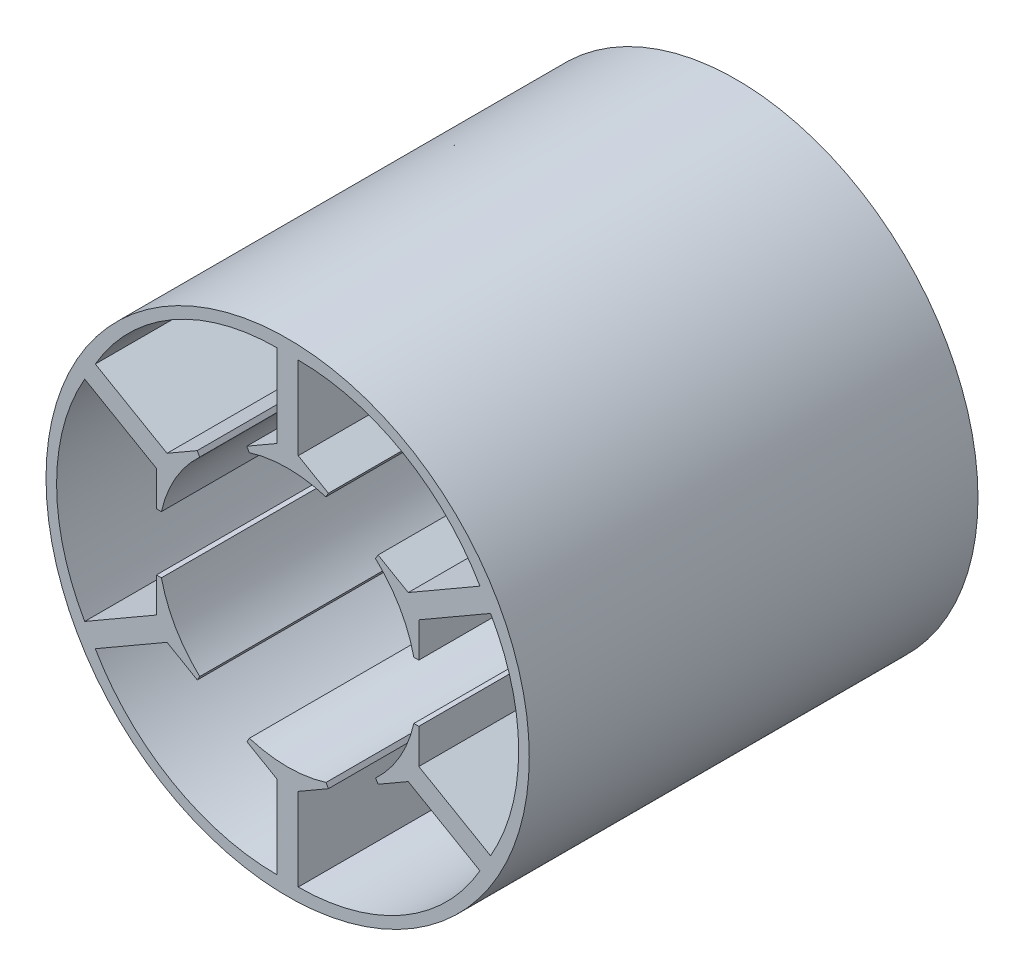
from build123d import *

# Parameters (mm, degrees)
MOTOR_BASE_R                    = 35
STATOR_SHELL_DEPTH              = 65
MOTOR_BASE_4_R                  = 18.75
CUT_EXTRUDE1_DEPTH              = 82.700673192
STATOR_LAMINATION_SUPPORT_DEPTH = 17.35
CUT_EXTRUDE3_DEPTH              = 82.700673192


with BuildPart() as part:
    # Motor_Base → Stator_Shell (new body)
    with BuildSketch(Plane.XY):
        Circle(MOTOR_BASE_R)
        with BuildLine():
            Line((1.533091596, 21.069409042), (1.533091596, 33.069409042))
            ThreePointArc((1.533091596, 33.069409042), (16.733091596, 28.996581317), (27.860263871, 17.869409042))
            Line((27.860263871, 17.869409042), (17.467959025, 11.869409042))
            Line((17.467959025, 11.869409042), (1.533091596, 21.069409042))
        make_face(mode=Mode.SUBTRACT)
        with BuildLine():
            Line((-1.533091596, 21.069409042), (-1.533091596, 33.069409042))
            ThreePointArc((-1.533091596, 33.069409042), (-16.733091596, 28.996581317), (-27.860263871, 17.869409042))
            Line((-27.860263871, 17.869409042), (-17.467959025, 11.869409042))
            Line((-17.467959025, 11.869409042), (-1.533091596, 21.069409042))
        make_face(mode=Mode.SUBTRACT)
        with BuildLine():
            Line((19.001050621, 9.214016506), (29.393355467, 15.214016506))
            ThreePointArc((29.393355467, 15.214016506), (33.466183191, 0.014016506), (29.393355467, -15.185983494))
            Line((29.393355467, -15.185983494), (19.001050621, -9.185983494))
            Line((19.001050621, -9.185983494), (19.001050621, 9.214016506))
        make_face(mode=Mode.SUBTRACT)
        with BuildLine():
            Line((17.467959025, -11.841376031), (27.860263871, -17.841376031))
            ThreePointArc((27.860263871, -17.841376031), (16.733091596, -28.968548306), (1.533091596, -33.041376031))
            Line((1.533091596, -33.041376031), (1.533091596, -21.041376031))
            Line((1.533091596, -21.041376031), (17.467959025, -11.841376031))
        make_face(mode=Mode.SUBTRACT)
        with BuildLine():
            Line((-1.533091596, -21.041376031), (-1.533091596, -33.041376031))
            ThreePointArc((-1.533091596, -33.041376031), (-16.733091596, -28.968548306), (-27.860263871, -17.841376031))
            Line((-27.860263871, -17.841376031), (-17.467959025, -11.841376031))
            Line((-17.467959025, -11.841376031), (-1.533091596, -21.041376031))
        make_face(mode=Mode.SUBTRACT)
        with BuildLine():
            Line((-19.001050621, -9.185983494), (-29.393355467, -15.185983494))
            ThreePointArc((-29.393355467, -15.185983494), (-33.466183191, 0.014016506), (-29.393355467, 15.214016506))
            Line((-29.393355467, 15.214016506), (-19.001050621, 9.214016506))
            Line((-19.001050621, 9.214016506), (-19.001050621, -9.185983494))
        make_face(mode=Mode.SUBTRACT)
    extrude(amount=STATOR_SHELL_DEPTH)

    # Motor_Base<4> → Cut-Extrude1 (cut, through all)
    with BuildSketch(Plane.XY):
        Circle(MOTOR_BASE_4_R)
    extrude(amount=CUT_EXTRUDE1_DEPTH, mode=Mode.SUBTRACT)

    # Stator_Lam_Support → Stator Lamination Support (add)
    with BuildSketch(Plane(origin=(0, 0, 0), x_dir=(-1, 0, 0), z_dir=(0, 0, -1))):
        with BuildLine():
            Line((14.351295245, 31.306334292), (13.506552589, 28.096442893))
            Line((13.506552589, 28.096442893), (17.559972866, 25.758191299))
            Line((17.559972866, 25.758191299), (19.915725917, 28.096442893))
            ThreePointArc((19.915725917, 28.096442893), (17.208516366, 29.831413083), (14.351295245, 31.306334292))
        make_face()
        with BuildLine():
            Line((34.287728419, 3.224580887), (31.085509595, 2.351203787))
            Line((31.085509595, 2.351203787), (31.087234454, -2.328286942))
            Line((31.087234454, -2.328286942), (34.29009626, -3.199303133))
            ThreePointArc((34.29009626, -3.199303133), (34.439019743, 0.012694207), (34.287728419, 3.224580887))
        make_face()
        with BuildLine():
            Line((19.936433174, -28.081753405), (17.578957007, -25.745239106))
            Line((17.578957007, -25.745239106), (13.527261587, -28.086478241))
            Line((13.527261587, -28.086478241), (14.374370343, -31.295746025))
            ThreePointArc((14.374370343, -31.295746025), (17.230503377, -29.818718876), (19.936433174, -28.081753405))
        make_face()
        with BuildLine():
            Line((-14.351295245, -31.306334292), (-13.506552589, -28.096442893))
            Line((-13.506552589, -28.096442893), (-17.559972866, -25.758191299))
            Line((-17.559972866, -25.758191299), (-19.915725917, -28.096442893))
            ThreePointArc((-19.915725917, -28.096442893), (-17.208516366, -29.831413083), (-14.351295245, -31.306334292))
        make_face()
        with BuildLine():
            Line((-34.287728419, -3.224580887), (-31.085509595, -2.351203787))
            Line((-31.085509595, -2.351203787), (-31.087234454, 2.328286942))
            Line((-31.087234454, 2.328286942), (-34.29009626, 3.199303133))
            ThreePointArc((-34.29009626, 3.199303133), (-34.439019743, -0.012694207), (-34.287728419, -3.224580887))
        make_face()
        with BuildLine():
            Line((-19.936433174, 28.081753405), (-17.578957007, 25.745239106))
            Line((-17.578957007, 25.745239106), (-13.527261587, 28.086478241))
            Line((-13.527261587, 28.086478241), (-14.374370343, 31.295746025))
            ThreePointArc((-14.374370343, 31.295746025), (-17.230503377, 29.818718876), (-19.936433174, 28.081753405))
        make_face()
    extrude(amount=-STATOR_LAMINATION_SUPPORT_DEPTH)

    # Sketch6 → Cut-Extrude3 (cut, through all)
    with BuildSketch(Plane.XY.offset(65)):
        Polygon((14.405256844, 16.666586459), (11.56399771, 11.741189457), (4.374457659, 15.888539677), (7.215716793, 20.813936679), align=None)
        Polygon((21.633256314, 4.15797429), (21.63631569, -4.142025146), (15.950167195, -4.144121058), (15.947107819, 4.155878379), align=None)
        Polygon((14.417539521, -16.655962389), (7.231058845, -20.808611605), (4.386169485, -15.885310514), (11.57265016, -11.732661299), align=None)
        Polygon((-7.215716793, -20.813936679), (-14.405256844, -16.666586459), (-11.56399771, -11.741189457), (-4.374457659, -15.888539677), align=None)
        Polygon((-21.633256314, -4.15797429), (-21.63631569, 4.142025146), (-15.950167195, 4.144121058), (-15.947107819, -4.155878379), align=None)
        Polygon((-14.417539521, 16.655962389), (-7.231058845, 20.808611605), (-4.386169485, 15.885310514), (-11.57265016, 11.732661299), align=None)
    extrude(amount=-CUT_EXTRUDE3_DEPTH, mode=Mode.SUBTRACT)


solid = part.part
